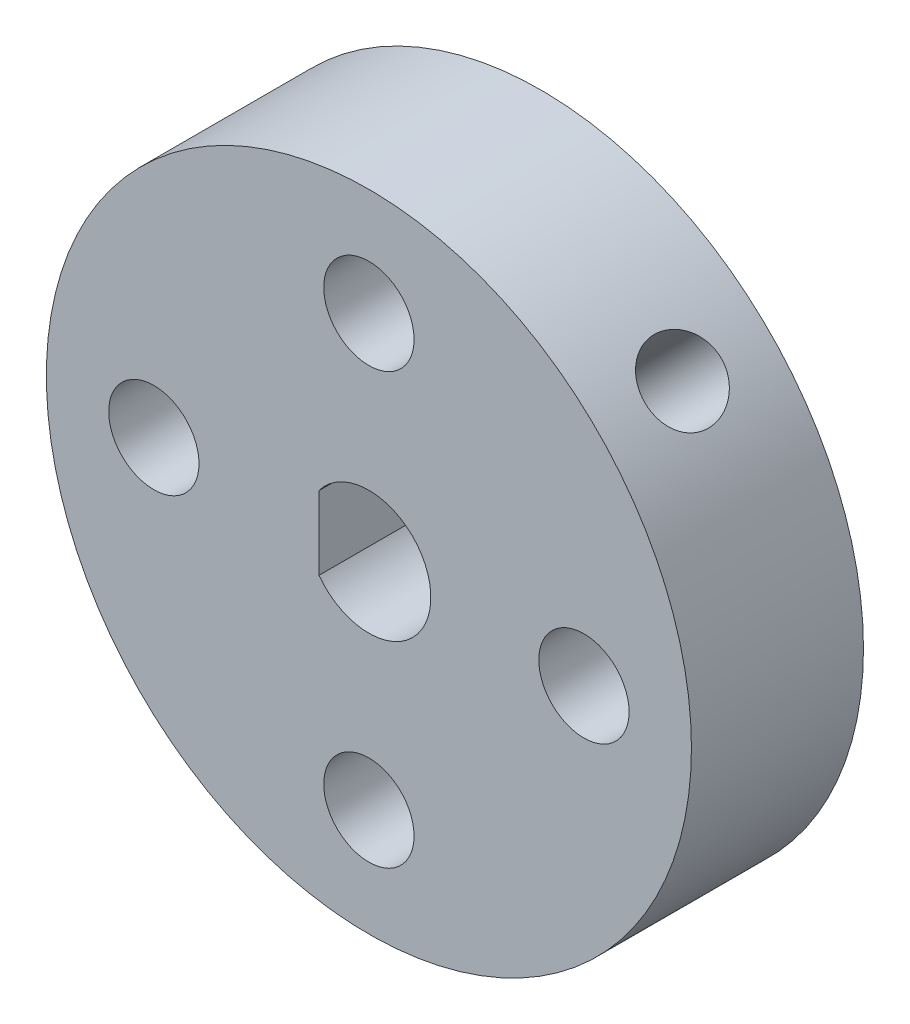
from build123d import *

# Parameters (mm, degrees)
SKETCH1_R           = 9.525
SKETCH1_R_2         = 1.3335
BOSS_EXTRUDE1_DEPTH = 5.08
SKETCH2_R           = 1.1303
CUT_EXTRUDE1_DEPTH  = 10.16


with BuildPart() as part:
    # Sketch1 → Boss-Extrude1 (new body)
    with BuildSketch(Plane.XY):
        Circle(SKETCH1_R)
        with Locations((-6.35, 0)):
            Circle(SKETCH1_R_2, mode=Mode.SUBTRACT)
        with Locations((0, 6.35)):
            Circle(SKETCH1_R_2, mode=Mode.SUBTRACT)
        with Locations((6.35, 0)):
            Circle(SKETCH1_R_2, mode=Mode.SUBTRACT)
        with Locations((0, -6.35)):
            Circle(SKETCH1_R_2, mode=Mode.SUBTRACT)
        with BuildLine():
            Line((-1.4732, 1.083601034), (-1.4732, -1.083601034))
            ThreePointArc((-1.4732, -1.083601034), (1.8288, 0), (-1.4732, 1.083601034))
        make_face(mode=Mode.SUBTRACT)
    extrude(amount=BOSS_EXTRUDE1_DEPTH)

    # Sketch2 → Cut-Extrude1 (cut)
    with BuildSketch(Plane(origin=(6.735192091, 6.735192091, 0), x_dir=(-0.7071067811865476, 0.7071067811865476, 0), z_dir=(0.7071067811865476, 0.7071067811865476, 0))):
        with Locations((0, 2.54)):
            Circle(SKETCH2_R)
    extrude(amount=-CUT_EXTRUDE1_DEPTH, mode=Mode.SUBTRACT)


solid = part.part
